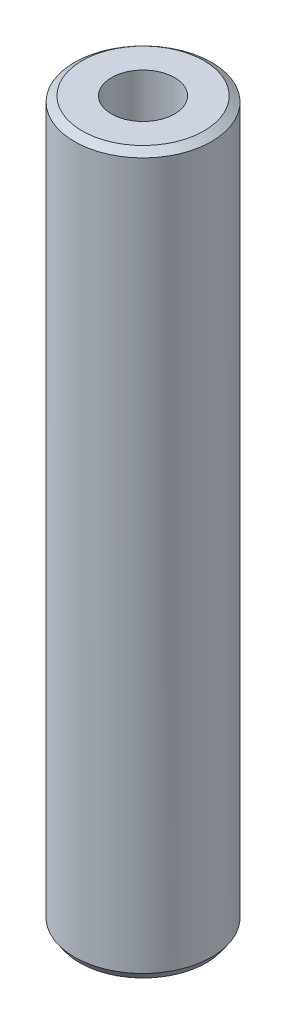
from build123d import *
from OCP.BRepFilletAPI import BRepFilletAPI_MakeChamfer

# Parameters (mm, degrees)
SKETCH1_R           = 40
BOSS_EXTRUDE1_DEPTH = 419.4666323
SKETCH2_R           = 18.395184598
CUT_EXTRUDE1_DEPTH  = 424.263813257
CHAMFER1_SIZE       = 3.114618733
CHAMFER1_SIZE2      = 4.477654661


with BuildPart() as part:
    # Sketch1 → Boss-Extrude1 (new body)
    with BuildSketch(Plane(origin=(0, 0, 0), x_dir=(1, 0, 0), z_dir=(0, 1, 0))):
        Circle(SKETCH1_R)
    extrude(amount=BOSS_EXTRUDE1_DEPTH)

    # Sketch2 → Cut-Extrude1 (cut, through all)
    with BuildSketch(Plane(origin=(0, 0, 0), x_dir=(1, 0, 0), z_dir=(0, 1, 0))):
        Circle(SKETCH2_R)
    extrude(amount=CUT_EXTRUDE1_DEPTH, mode=Mode.SUBTRACT)

    # Chamfer1: one chamfer whose edges measure the first distance from different faces: ONE call of the kernel's chamfer builder (chamfer() names one face for all edges)
    chamfer1_edges_1 = [part.edges().sort_by_distance(p)[0] for p in [
        (-40, 419.4666323, 0),
    ]]
    chamfer1_side_1 = [part.faces().sort_by_distance(p)[0] for p in [
        (-40, 209.73331615, 0),
    ]]
    chamfer1_edges_2 = [part.edges().sort_by_distance(p)[0] for p in [
        (-40, 0, 0),
    ]]
    chamfer1_side_2 = [part.faces().sort_by_distance(p)[0] for p in [
        (-38.86862915, 0, 0),
    ]]
    chamfer1 = BRepFilletAPI_MakeChamfer(part.part.solid().wrapped)
    for e in chamfer1_edges_1:
        chamfer1.Add(CHAMFER1_SIZE, CHAMFER1_SIZE2, e.wrapped, chamfer1_side_1[0].wrapped)  # the first distance lies on this face
    for e in chamfer1_edges_2:
        chamfer1.Add(CHAMFER1_SIZE, CHAMFER1_SIZE2, e.wrapped, chamfer1_side_2[0].wrapped)  # the first distance lies on this face
    add(Compound.cast(chamfer1.Shape()), mode=Mode.REPLACE)


solid = part.part
